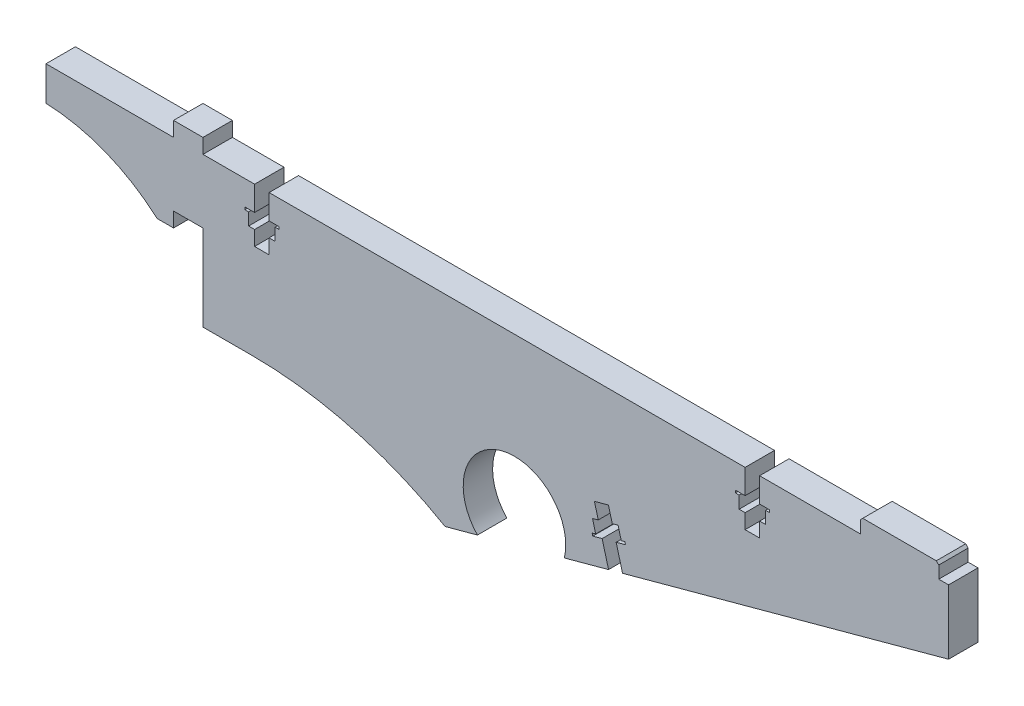
from build123d import *

# Parameters (mm, degrees)
BOSS_EXTRUDE1_DEPTH = 6
CHAMFER2_SIZE       = 0.5
CUT_EXTRUDE1_DEPTH  = 171.168299045


with BuildPart() as part:
    # Sketch1 → Boss-Extrude1 (new body)
    with BuildSketch(Plane.XY):
        with BuildLine():
            Line((127.02, 20), (127.02, 15))
            Line((127.02, 15), (125.05, 15))
            Line((125.05, 15), (125.05, 14.5))
            Line((125.05, 14.5), (125.8, 14.5))
            Line((125.8, 14.5), (125.8, 12))
            Line((125.8, 12), (127.02, 12))
            Line((127.02, 12), (127.02, 9))
            Line((127.02, 9), (129.98, 9))
            Line((129.98, 9), (129.98, 12))
            Line((129.98, 12), (131.2, 12))
            Line((131.2, 12), (131.2, 14.5))
            Line((131.2, 14.5), (131.95, 14.5))
            Line((131.95, 14.5), (131.95, 15))
            Line((131.95, 15), (129.98, 15))
            Line((129.98, 15), (129.98, 20))
            Line((129.98, 20), (150.5, 20))
            Line((150.5, 20), (150.5, 23))
            Line((150.5, 23), (166.5, 23))
            Line((166.5, 23), (166.5, 20))
            Line((166.5, 20), (168.5, 20))
            Line((168.5, 20), (168.5, 6.863824327))
            Line((168.5, 6.863824327), (90.166126815, -14.419166297))
            ThreePointArc((90.166126815, -14.419166297), (77.260105301, -1.915582464), (72.455781987, -19.230994024))
            Line((72.455781987, -19.230994024), (65.870697887, -21.020134245))
            ThreePointArc((65.870697887, -21.020134245), (46.875997378, -13.175374737), (26.5, -10.5))
            Line((26.5, -10.5), (16.5, -10.5))
            Line((16.5, -10.5), (16.5, 7))
            Line((16.5, 7), (10.5, 7))
            Line((10.5, 7), (10.5, 4))
            Line((10.5, 4), (7.175208673, 4))
            ThreePointArc((7.175208673, 4), (-3.379910387, 10.471446325), (-15.5, 13))
            Line((-15.5, 13), (-15.5, 20))
            Line((-15.5, 20), (10.5, 20))
            Line((10.5, 20), (10.5, 23))
            Line((10.5, 23), (16.5, 23))
            Line((16.5, 23), (16.5, 20))
            Line((16.5, 20), (27.02, 20))
            Line((27.02, 20), (27.02, 15))
            Line((27.02, 15), (25.05, 15))
            Line((25.05, 15), (25.05, 14.5))
            Line((25.05, 14.5), (25.8, 14.5))
            Line((25.8, 14.5), (25.8, 12))
            Line((25.8, 12), (27.02, 12))
            Line((27.02, 12), (27.02, 9))
            Line((27.02, 9), (29.98, 9))
            Line((29.98, 9), (29.98, 12))
            Line((29.98, 12), (31.2, 12))
            Line((31.2, 12), (31.2, 14.5))
            Line((31.2, 14.5), (31.95, 14.5))
            Line((31.95, 14.5), (31.95, 15))
            Line((31.95, 15), (29.98, 15))
            Line((29.98, 15), (29.98, 20))
            Line((29.98, 20), (127.02, 20))
        make_face()
    extrude(amount=BOSS_EXTRUDE1_DEPTH)

    # Chamfer2
    chamfer2_edges = [part.edges().sort_by_distance(p)[0] for p in [
        (166.5, 23, 3),
        (150.5, 23, 3),
    ]]
    chamfer(chamfer2_edges, length=CHAMFER2_SIZE)

    # Sketch2 → Cut-Extrude1 (cut, through all)
    with BuildSketch(Plane.XY.offset(6)):
        Polygon((102.039498772, -11.193220053), (99.183051317, -11.969305058), (97.872096915, -7.144224897), (95.971015332, -7.660740932), (95.839919892, -7.178232916), (96.563681916, -6.981589755), (95.908204715, -4.569049675), (97.085524275, -4.249176801), (96.298951634, -1.354128705), (99.155399089, -0.578043699), (99.94197173, -3.473091795), (101.119291289, -3.153218921), (101.77476849, -5.565759002), (102.498530514, -5.369115842), (102.629625954, -5.851623858), (100.728544371, -6.368139892), align=None)
    extrude(amount=-CUT_EXTRUDE1_DEPTH, mode=Mode.SUBTRACT)


solid = part.part
